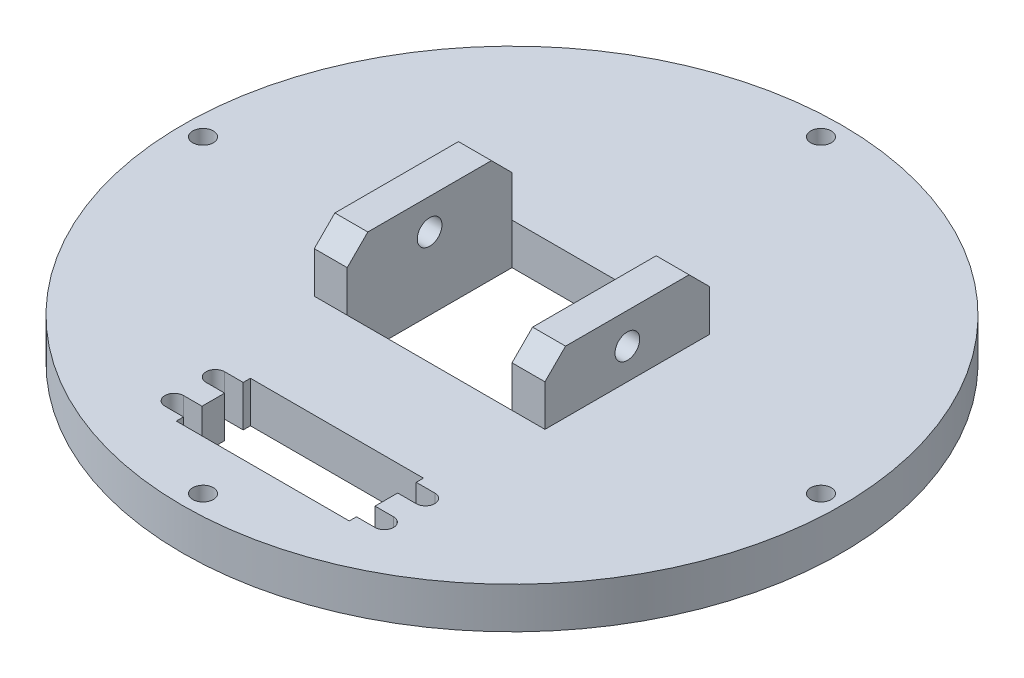
from build123d import *

# Parameters (mm, degrees)
SKETCH1_R               = 80
BOSS_EXTRUDE1_DEPTH     = 10
CUT_EXTRUDE1_REACH      = 115.578
SKETCH2_R               = 2.5
CUT_EXTRUDE2_REACH      = 115.578
SKETCH3_W               = 40
SKETCH3_H               = 40
CUT_EXTRUDE3_REACH      = 115.578
SKETCH5_W               = 8
SKETCH5_H               = 40
BOSS_EXTRUDE2_DEPTH     = 15
FILLET1_SIZE            = 5
CUT_EXTRUDE4_REACH      = 138.708
SKETCH6_R               = 3
FILLET1_OF_MIRROR1_SIZE = 5


with BuildPart() as part:
    # Sketch1 → Boss-Extrude1 (new body)
    with BuildSketch(Plane(origin=(0, 0, 0), x_dir=(1, 0, 0), z_dir=(0, 1, 0))):
        Circle(SKETCH1_R)
    extrude(amount=BOSS_EXTRUDE1_DEPTH)

    # Sketch2 → Cut-Extrude1 (cut, up to next)
    with BuildSketch(Plane(origin=(0, 10, 0), x_dir=(1, 0, 0), z_dir=(0, 1, 0)), mode=Mode.PRIVATE) as cut_extrude1_sk1:
        with Locations((-75, 0)):
            Circle(SKETCH2_R)
    cut_extrude1_tool1 = extrude(cut_extrude1_sk1.sketch, amount=-CUT_EXTRUDE1_REACH, mode=Mode.PRIVATE) & part.part
    # Sketch2 → Cut-Extrude1 (cut, up to next)
    with BuildSketch(Plane(origin=(0, 10, 0), x_dir=(1, 0, 0), z_dir=(0, 1, 0)), mode=Mode.PRIVATE) as cut_extrude1_sk2:
        with Locations((0, 75)):
            Circle(SKETCH2_R)
    cut_extrude1_tool2 = extrude(cut_extrude1_sk2.sketch, amount=-CUT_EXTRUDE1_REACH, mode=Mode.PRIVATE) & part.part
    # Sketch2 → Cut-Extrude1 (cut, up to next)
    with BuildSketch(Plane(origin=(0, 10, 0), x_dir=(1, 0, 0), z_dir=(0, 1, 0)), mode=Mode.PRIVATE) as cut_extrude1_sk3:
        with Locations((75, 0)):
            Circle(SKETCH2_R)
    cut_extrude1_tool3 = extrude(cut_extrude1_sk3.sketch, amount=-CUT_EXTRUDE1_REACH, mode=Mode.PRIVATE) & part.part
    # Sketch2 → Cut-Extrude1 (cut, up to next)
    with BuildSketch(Plane(origin=(0, 10, 0), x_dir=(1, 0, 0), z_dir=(0, 1, 0)), mode=Mode.PRIVATE) as cut_extrude1_sk4:
        with Locations((0, -75)):
            Circle(SKETCH2_R)
    cut_extrude1_tool4 = extrude(cut_extrude1_sk4.sketch, amount=-CUT_EXTRUDE1_REACH, mode=Mode.PRIVATE) & part.part
    add(cut_extrude1_tool1.solids().sort_by_distance((-75, 10, 0))[0], mode=Mode.SUBTRACT)
    add(cut_extrude1_tool2.solids().sort_by_distance((0, 10, -75))[0], mode=Mode.SUBTRACT)
    add(cut_extrude1_tool3.solids().sort_by_distance((75, 10, 0))[0], mode=Mode.SUBTRACT)
    add(cut_extrude1_tool4.solids().sort_by_distance((0, 10, 75))[0], mode=Mode.SUBTRACT)

    # Sketch3 → Cut-Extrude2 (cut, up to next)
    with BuildSketch(Plane(origin=(0, 10, 0), x_dir=(1, 0, 0), z_dir=(0, 1, 0)), mode=Mode.PRIVATE) as cut_extrude2_sk1:
        Rectangle(SKETCH3_W, SKETCH3_H)
    cut_extrude2_tool1 = extrude(cut_extrude2_sk1.sketch, amount=-CUT_EXTRUDE2_REACH, mode=Mode.PRIVATE) & part.part
    add(cut_extrude2_tool1.solids().sort_by_distance((0, 10, 0))[0], mode=Mode.SUBTRACT)

    # Sketch4 → Cut-Extrude3 (cut, up to next)
    with BuildSketch(Plane(origin=(0, 10, 0), x_dir=(1, 0, 0), z_dir=(0, 1, 0)), mode=Mode.PRIVATE) as cut_extrude3_sk1:
        with BuildLine():
            Line((23.5, -45), (-18.5, -45))
            Line((-18.5, -45), (-18.5, -46.75))
            Line((-18.5, -46.75), (-23, -46.75))
            ThreePointArc((-23, -46.75), (-25.25, -49), (-23, -51.25))
            Line((-23, -51.25), (-18.5, -51.25))
            Line((-18.5, -51.25), (-18.5, -56.75))
            Line((-18.5, -56.75), (-23, -56.75))
            ThreePointArc((-23, -56.75), (-25.25, -59), (-23, -61.25))
            Line((-23, -61.25), (-18.5, -61.25))
            Line((-18.5, -61.25), (-18.5, -63))
            Line((-18.5, -63), (23.5, -63))
            Line((23.5, -63), (23.5, -61.25))
            Line((23.5, -61.25), (28, -61.25))
            ThreePointArc((28, -61.25), (30.25, -59), (28, -56.75))
            Line((28, -56.75), (23.5, -56.75))
            Line((23.5, -56.75), (23.5, -51.25))
            Line((23.5, -51.25), (28, -51.25))
            ThreePointArc((28, -51.25), (30.25, -49), (28, -46.75))
            Line((28, -46.75), (23.5, -46.75))
            Line((23.5, -46.75), (23.5, -45))
        make_face()
    cut_extrude3_tool1 = extrude(cut_extrude3_sk1.sketch, amount=-CUT_EXTRUDE3_REACH, mode=Mode.PRIVATE) & part.part
    add(cut_extrude3_tool1.solids().sort_by_distance((2.5, 10, 54))[0], mode=Mode.SUBTRACT)

    # Sketch5 → Boss-Extrude2 (add)
    with BuildSketch(Plane(origin=(0, 10, 0), x_dir=(1, 0, 0), z_dir=(0, 1, 0))):
        with Locations((-24, 0)):
            Rectangle(SKETCH5_W, SKETCH5_H)
    boss_extrude2 = extrude(amount=BOSS_EXTRUDE2_DEPTH)

    # Fillet1
    fillet1_edges = [part.edges().sort_by_distance(p)[0] for p in [
        (-24, 25, -20),
        (-24, 25, 20),
    ]]
    chamfer(fillet1_edges, length=FILLET1_SIZE)

    # Sketch6 → Cut-Extrude4 (cut, up to next)
    with BuildSketch(Plane.ZY.offset(28), mode=Mode.PRIVATE) as cut_extrude4_sk1:
        with Locations((0, 17.5)):
            Circle(SKETCH6_R)
    cut_extrude4_tool1 = extrude(cut_extrude4_sk1.sketch, amount=-CUT_EXTRUDE4_REACH, mode=Mode.PRIVATE) & part.part
    cut_extrude4 = cut_extrude4_tool1.solids().sort_by_distance((-28, 17.5, 0))[0]
    add(cut_extrude4, mode=Mode.SUBTRACT)

    # Mirror1: Boss-Extrude2, Cut-Extrude4 across plane
    add(boss_extrude2.mirror(Plane.ZY))
    add(cut_extrude4.mirror(Plane.ZY), mode=Mode.SUBTRACT)

    # Fillet1 of Mirror1
    fillet1_of_mirror1_edges = [part.edges().sort_by_distance(p)[0] for p in [
        (24, 25, -20),
        (24, 25, 20),
    ]]
    chamfer(fillet1_of_mirror1_edges, length=FILLET1_OF_MIRROR1_SIZE)


solid = part.part
